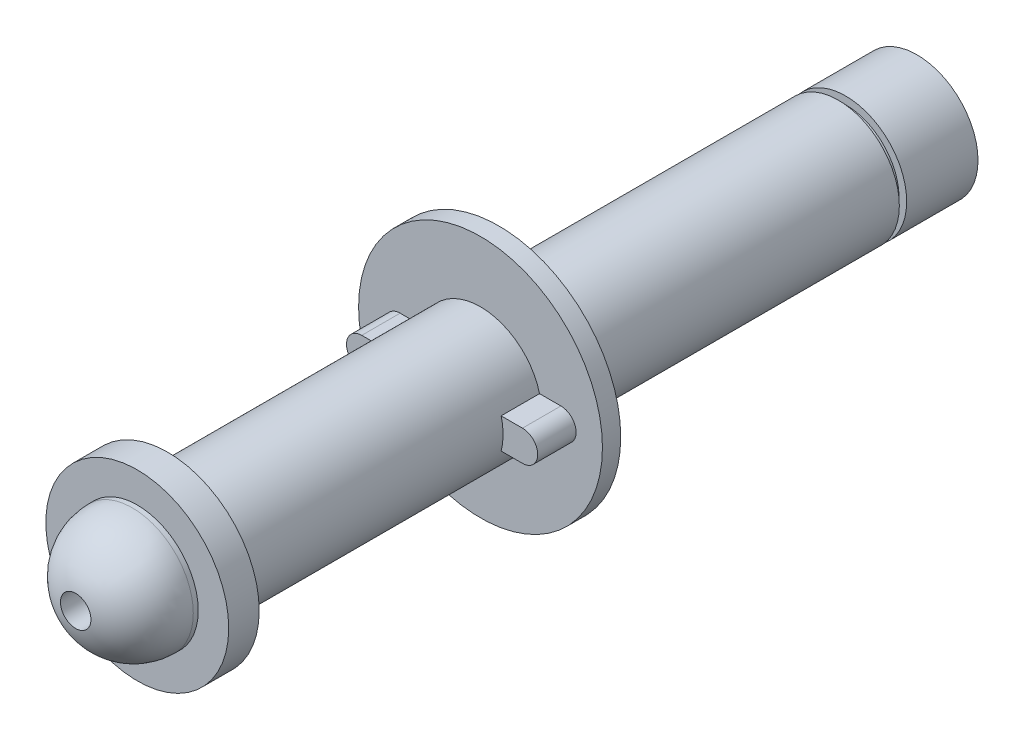
from build123d import *

# Parameters (mm, degrees)
SKETCH1_R               = 20
SKETCH1_R_2             = 5
BOSS_EXTRUDE1_DEPTH     = 166
ENL_V_START             = -142.6
ESQUISSE3_R             = 20
ESQUISSE3_R_2           = 17.5
ENL_V_MAT_EXTRU_1_DEPTH = 2.4
ENL_V_START_2           = -32.2
ESQUISSE4_R             = 20
ESQUISSE4_R_2           = 17.5
ENL_V_MAT_EXTRU_2_DEPTH = 2.4
BOSS_EXTRU_1_START      = -22.8
BOSS_EXTRU_1_DEPTH      = 12.6
ESQUISSE6_R             = 20
ESQUISSE6_R_2           = 5
BOSS_EXTRU_2_DEPTH      = 110
BOSS_EXTRU_3_START      = -132.8
ESQUISSE7_R             = 40
BOSS_EXTRU_3_DEPTH      = 6
BOSS_EXTRU_4_START      = -30.2
ESQUISSE8_R             = 30
BOSS_EXTRU_4_DEPTH      = 10
CONG_3_R                = 19
ECHELLE1_SCALE          = 0.25


with BuildPart() as part:
    # Sketch1 → Boss-Extrude1 (new body)
    with BuildSketch(Plane.XY):
        Circle(SKETCH1_R)
        Circle(SKETCH1_R_2, mode=Mode.SUBTRACT)
    extrude(amount=BOSS_EXTRUDE1_DEPTH)

    # Esquisse3 → Enlèv. mat.-Extru.1 (cut)
    with BuildSketch(Plane.XY.offset(166).offset(ENL_V_START)):
        Circle(ESQUISSE3_R)
        Circle(ESQUISSE3_R_2, mode=Mode.SUBTRACT)
    extrude(amount=ENL_V_MAT_EXTRU_1_DEPTH, mode=Mode.SUBTRACT)

    # Esquisse4 → Enlèv. mat.-Extru.2 (cut)
    with BuildSketch(Plane.XY.offset(166).offset(ENL_V_START_2)):
        Circle(ESQUISSE4_R)
        Circle(ESQUISSE4_R_2, mode=Mode.SUBTRACT)
    extrude(amount=ENL_V_MAT_EXTRU_2_DEPTH, mode=Mode.SUBTRACT)

    # Esquisse5 → Boss.-Extru.1 (add)
    with BuildSketch(Plane.XY.offset(166).offset(BOSS_EXTRU_1_START)):
        with BuildLine():
            Line((-19.364916731, 5), (-26.364916731, 5))
            ThreePointArc((-26.364916731, 5), (-31.364916731, 0), (-26.364916731, -5))
            Line((-26.364916731, -5), (-19.364916731, -5))
            ThreePointArc((-19.364916731, -5), (-20, 0), (-19.364916731, 5))
        make_face()
        with BuildLine():
            Line((19.364916731, -5), (26.364916731, -5))
            ThreePointArc((26.364916731, -5), (31.364916731, 0), (26.364916731, 5))
            Line((26.364916731, 5), (19.364916731, 5))
            ThreePointArc((19.364916731, 5), (20, 0), (19.364916731, -5))
        make_face()
    extrude(amount=BOSS_EXTRU_1_DEPTH)

    # Esquisse6 → Boss.-Extru.2 (add)
    with BuildSketch(Plane.XY.offset(166)):
        Circle(ESQUISSE6_R)
        Circle(ESQUISSE6_R_2, mode=Mode.SUBTRACT)
    extrude(amount=BOSS_EXTRU_2_DEPTH)

    # Esquisse7 → Boss.-Extru.3 (add)
    with BuildSketch(Plane.XY.offset(276).offset(BOSS_EXTRU_3_START)):
        Circle(ESQUISSE7_R)
    extrude(amount=-BOSS_EXTRU_3_DEPTH)

    # Esquisse8 → Boss.-Extru.4 (add)
    with BuildSketch(Plane.XY.offset(276).offset(BOSS_EXTRU_4_START)):
        Circle(ESQUISSE8_R)
    extrude(amount=BOSS_EXTRU_4_DEPTH)

    # Congé3
    # the kernel refuses this fillet: 19 mm, written as the material it takes off along each edge
    with BuildSketch(Plane(origin=(0, 0, 276), x_dir=(1, 0, 0), z_dir=(0, -1, 0))) as cong_3_piece_1:
        with BuildLine():
            CenterArc((1, -18.574175621), CONG_3_R, 0, 77.846802531)
            Line((5, 0), (5.08, 0.371483512))
            ThreePointArc((5.08, 0.371483512), (12.5, 0.38), (20, 0.38))
            Line((20, 0.38), (20.38, 0))
            Line((20.38, 0), (20.38, -18.574175621))
            Line((20.38, -18.574175621), (20, -18.574175621))
        make_face()
    revolve(axis=Axis((0, 0, 276), (0, 0, 1)), mode=Mode.SUBTRACT)


with BuildPart() as part_1:
    # Echelle1: scaled about (0, 0, 140.981437802)
    add(part.part.scale(ECHELLE1_SCALE).moved(Location((0, 0, 105.736078351))))


solid = part_1.part
